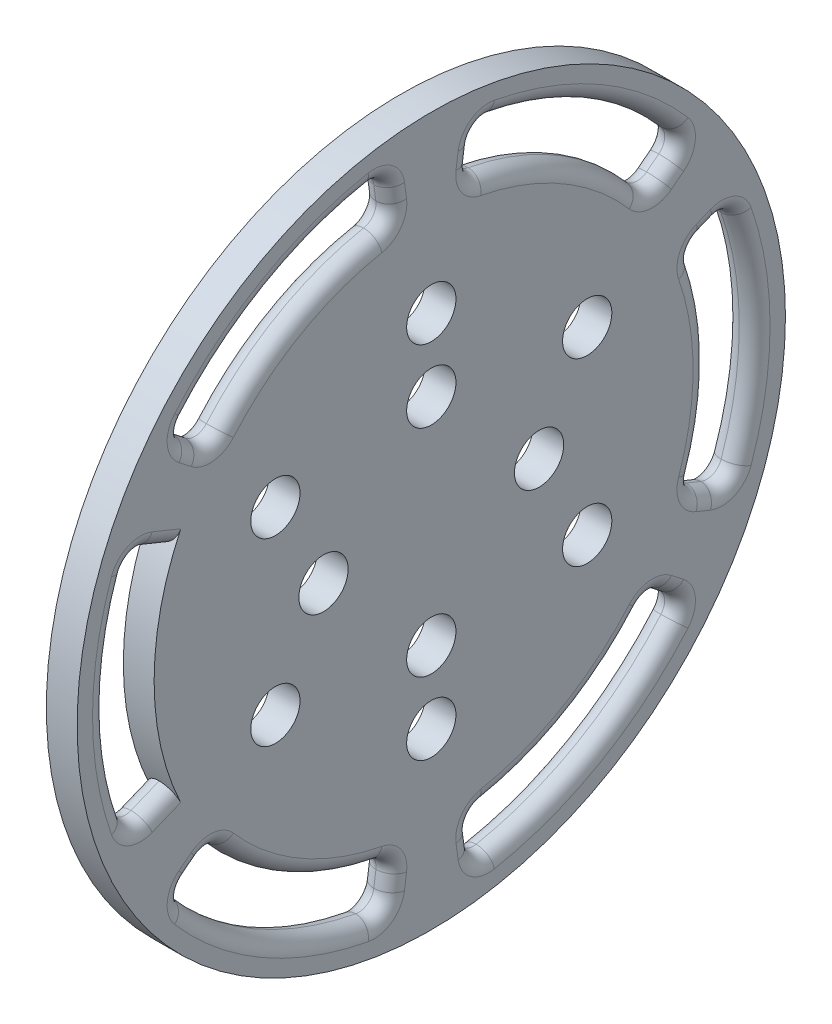
from build123d import *

# Parameters (mm, degrees)
SKETCH1_R           = 23
SKETCH1_R_2         = 1.6
BOSS_EXTRUDE1_DEPTH = 2
FILLET1_R           = 1
SKETCH2_R           = 1.6
CUT_EXTRUDE1_DEPTH  = 33.58834148


with BuildPart() as part:
    # Sketch1 → Boss-Extrude1 (new body)
    with BuildSketch(Plane(origin=(0, 0, 0), x_dir=(0, 0, -1), z_dir=(1, 0, 0))):
        Circle(SKETCH1_R)
        with Locations((-10.125, 5.845671476)):
            Circle(SKETCH1_R_2, mode=Mode.SUBTRACT)
        with Locations((-10.125, -5.845671476)):
            Circle(SKETCH1_R_2, mode=Mode.SUBTRACT)
        with Locations((0, -11.691342951)):
            Circle(SKETCH1_R_2, mode=Mode.SUBTRACT)
        with Locations((10.125, -5.845671476)):
            Circle(SKETCH1_R_2, mode=Mode.SUBTRACT)
        with Locations((10.125, 5.845671476)):
            Circle(SKETCH1_R_2, mode=Mode.SUBTRACT)
        with Locations((0, 11.691342951)):
            Circle(SKETCH1_R_2, mode=Mode.SUBTRACT)
        with BuildLine():
            ThreePointArc((14.210109765, -11.048655143), (9, -15.588457268), (2.463361149, -17.830643619))
            Line((2.463361149, -17.830643619), (2.87392134, -20.802417555))
            ThreePointArc((2.87392134, -20.802417555), (10.5, -18.186533479), (16.578461393, -12.890097666))
            Line((16.578461393, -12.890097666), (14.210109765, -11.048655143))
        make_face(mode=Mode.SUBTRACT)
        with BuildLine():
            ThreePointArc((-19.452382733, 7.912319889), (-21, 0), (-19.452382733, -7.912319889))
            Line((-19.452382733, -7.912319889), (-16.673470914, -6.781988476))
            ThreePointArc((-16.673470914, -6.781988476), (-18, 0), (-16.673470914, 6.781988476))
            Line((-16.673470914, 6.781988476), (-19.452382733, 7.912319889))
        make_face(mode=Mode.SUBTRACT)
        with BuildLine():
            ThreePointArc((16.578461393, 12.890097666), (10.5, 18.186533479), (2.87392134, 20.802417555))
            Line((2.87392134, 20.802417555), (2.463361149, 17.830643619))
            ThreePointArc((2.463361149, 17.830643619), (9, 15.588457268), (14.210109765, 11.048655143))
            Line((14.210109765, 11.048655143), (16.578461393, 12.890097666))
        make_face(mode=Mode.SUBTRACT)
        with BuildLine():
            Line((-2.87392134, 20.802417555), (-2.463361149, 17.830643619))
            ThreePointArc((-2.463361149, 17.830643619), (-9, 15.588457268), (-14.210109765, 11.048655143))
            Line((-14.210109765, 11.048655143), (-16.578461393, 12.890097666))
            ThreePointArc((-16.578461393, 12.890097666), (-10.5, 18.186533479), (-2.87392134, 20.802417555))
        make_face(mode=Mode.SUBTRACT)
        with BuildLine():
            Line((19.452382733, -7.912319889), (16.673470914, -6.781988476))
            ThreePointArc((16.673470914, -6.781988476), (18, 0), (16.673470914, 6.781988476))
            Line((16.673470914, 6.781988476), (19.452382733, 7.912319889))
            ThreePointArc((19.452382733, 7.912319889), (21, 0), (19.452382733, -7.912319889))
        make_face(mode=Mode.SUBTRACT)
        with BuildLine():
            Line((-16.578461393, -12.890097666), (-14.210109765, -11.048655143))
            ThreePointArc((-14.210109765, -11.048655143), (-9, -15.588457268), (-2.463361149, -17.830643619))
            Line((-2.463361149, -17.830643619), (-2.87392134, -20.802417555))
            ThreePointArc((-2.87392134, -20.802417555), (-10.5, -18.186533479), (-16.578461393, -12.890097666))
        make_face(mode=Mode.SUBTRACT)
    extrude(amount=BOSS_EXTRUDE1_DEPTH)

    # Fillet1
    fillet1_edges = [part.edges().sort_by_distance(p)[0] for p in [
        (1, -12.890097666, 16.578461393),
        (1, -20.802417555, 2.87392134),
        (1, -17.830643619, 2.463361149),
        (1, -11.048655143, 14.210109765),
        (1, -7.912319889, -19.452382733),
        (1, 7.912319889, -19.452382733),
        (1, 6.781988476, -16.673470914),
        (1, -6.781988476, -16.673470914),
        (1, 20.802417555, 2.87392134),
        (1, 12.890097666, 16.578461393),
        (1, 11.048655143, 14.210109765),
        (1, 17.830643619, 2.463361149),
        (1, 20.802417555, -2.87392134),
        (1, 17.830643619, -2.463361149),
        (1, 11.048655143, -14.210109765),
        (1, 12.890097666, -16.578461393),
        (1, -7.912319889, 19.452382733),
        (1, 7.912319889, 19.452382733),
        (1, -17.830643619, -2.463361149),
        (1, -20.802417555, -2.87392134),
        (1, -12.890097666, -16.578461393),
        (1, -11.048655143, -14.210109765),
    ]]
    fillet(fillet1_edges, radius=FILLET1_R)
    fillet1_2_edges = [part.edges().sort_by_distance(p)[0] for p in [
        (2, 19.291097312, 2.665127555),
        (2, 11.953616823, 15.374016561),
        (2, -7.337480489, -18.039144116),
        (2, 7.337480489, -18.039144116),
        (2, -11.953616823, 15.374016561),
        (2, -19.291097312, 2.665127555),
        (2, -11.953616823, -15.374016561),
        (2, -19.291097312, -2.665127555),
        (0, -19.291097312, 2.665127555),
        (0, -11.953616823, 15.374016561),
        (0, 7.337480489, -18.039144116),
        (0, -7.337480489, -18.039144116),
        (0, 11.953616823, 15.374016561),
        (0, 19.291097312, 2.665127555),
        (2, 7.154052952, 17.588188808),
        (0, 19.291097312, -2.665127555),
        (0, 11.953616823, -15.374016561),
        (0, -7.154052952, 17.588188808),
        (0, 7.154052952, 17.588188808),
        (0, -19.291097312, -2.665127555),
        (0, -11.953616823, -15.374016561),
        (2, -7.154052952, 17.588188808),
        (2, 11.953616823, -15.374016561),
        (2, 19.291097312, -2.665127555),
        (2, 20.462263856, -3.140677539),
        (2, 18.075807454, -2.774362517),
        (2, 11.440572146, -14.266927191),
        (2, 12.951038462, -16.150501549),
        (2, -7.511225394, 19.291179087),
        (0, -12.951038462, -16.150501549),
        (0, -11.440572146, -14.266927191),
        (0, -18.075807454, -2.774362517),
        (0, -20.462263856, -3.140677539),
        (0, 7.511225394, 19.291179087),
        (0, -7.511225394, 19.291179087),
        (0, 11.440572146, -14.266927191),
        (0, 12.951038462, -16.150501549),
        (0, 20.462263856, -3.140677539),
        (0, 18.075807454, -2.774362517),
        (2, 7.511225394, 19.291179087),
        (0, 20.462263856, 3.140677539),
        (0, 18.075807454, 2.774362517),
        (0, 11.440572146, 14.266927191),
        (0, 12.951038462, 16.150501549),
        (0, -7.511225394, -19.291179087),
        (0, -6.635235308, -17.041289708),
        (0, 6.635235308, -17.041289708),
        (0, 7.511225394, -19.291179087),
        (0, -12.951038462, 16.150501549),
        (0, -11.440572146, 14.266927191),
        (0, -18.075807454, 2.774362517),
        (0, -20.462263856, 3.140677539),
        (2, -18.075807454, -2.774362517),
        (2, -20.462263856, -3.140677539),
        (2, -12.951038462, -16.150501549),
        (2, -11.440572146, -14.266927191),
        (2, -18.075807454, 2.774362517),
        (2, -20.462263856, 3.140677539),
        (2, -12.951038462, 16.150501549),
        (2, -11.440572146, 14.266927191),
        (2, 6.635235308, -17.041289708),
        (2, 7.511225394, -19.291179087),
        (2, -7.511225394, -19.291179087),
        (2, -6.635235308, -17.041289708),
        (2, 11.440572146, 14.266927191),
        (2, 12.951038462, 16.150501549),
        (2, 20.462263856, 3.140677539),
        (2, 18.075807454, 2.774362517),
    ]]
    fillet(fillet1_2_edges, radius=FILLET1_R - 0.0001)  # a hair under: the kernel refuses the full size

    # Sketch2 → Cut-Extrude1 (cut, through all)
    with BuildSketch(Plane(origin=(2, 0, 0), x_dir=(0, 0, -1), z_dir=(1, 0, 0))):
        with Locations((7, 0)):
            Circle(SKETCH2_R)
        with Locations((0, -7)):
            Circle(SKETCH2_R)
        with Locations((-7, 0)):
            Circle(SKETCH2_R)
        with Locations((0, 7)):
            Circle(SKETCH2_R)
    extrude(amount=-CUT_EXTRUDE1_DEPTH, mode=Mode.SUBTRACT)


solid = part.part
